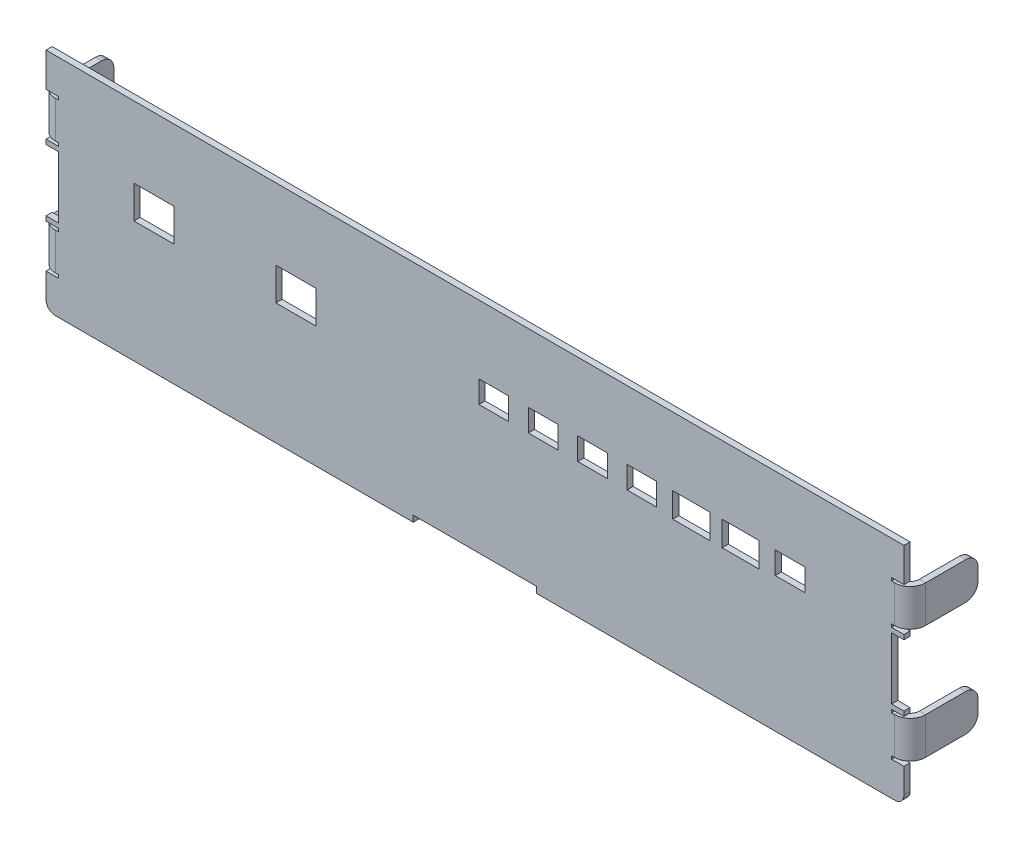
from build123d import *

# Parameters (mm, degrees)
SKETCH1_W                       = 139
SKETCH1_H                       = 36.5
BASE_FLANGE1_DEPTH              = 1
EDGE_FLANGE1_STRIP_W            = 7
EDGE_FLANGE1_STRIP_H            = 1
EDGE_FLANGE1_STRIP_CUT_DEPTH    = 6
EDGE_FLANGE1_RELIEF_W           = 7.5
EDGE_FLANGE1_RELIEF_H           = 0.5
EDGE_FLANGE1_RELIEF_CUT_DEPTH   = 1
EDGE_FLANGE1_STRIP_2_W          = 7
EDGE_FLANGE1_STRIP_2_H          = 1
EDGE_FLANGE1_STRIP_CUT_2_DEPTH  = 6
EDGE_FLANGE1_RELIEF_2_W         = 7.5
EDGE_FLANGE1_RELIEF_2_H         = 0.5
EDGE_FLANGE1_RELIEF_CUT_2_DEPTH = 1
EDGE_FLANGE1_DEPTH              = 6
EDGE_FLANGE1_START              = -1
EDGE_FLANGE1_FLAT_DEPTH         = 1
EDGE_FLANGE1_BEND_DEPTH         = 6
EDGE_FLANGE1_FLAT_2_DEPTH       = 1
EDGE_FLANGE2_STRIP_W            = 7
EDGE_FLANGE2_STRIP_H            = 1
EDGE_FLANGE2_STRIP_CUT_DEPTH    = 6
EDGE_FLANGE2_RELIEF_W           = 7.5
EDGE_FLANGE2_RELIEF_H           = 0.5
EDGE_FLANGE2_RELIEF_CUT_DEPTH   = 1
EDGE_FLANGE2_STRIP_2_W          = 7
EDGE_FLANGE2_STRIP_2_H          = 1
EDGE_FLANGE2_STRIP_CUT_2_DEPTH  = 6
EDGE_FLANGE2_RELIEF_2_W         = 7.5
EDGE_FLANGE2_RELIEF_2_H         = 0.5
EDGE_FLANGE2_RELIEF_CUT_2_DEPTH = 1
EDGE_FLANGE2_DEPTH              = 6
EDGE_FLANGE2_START              = 1
EDGE_FLANGE2_FLAT_DEPTH         = 1
EDGE_FLANGE2_BEND_DEPTH         = 6
EDGE_FLANGE2_FLAT_2_DEPTH       = 1
SKETCH20_W                      = 20
SKETCH20_H                      = 1
SKETCH20_W_2                    = 2
SKETCH20_H_2                    = 10
CUT_EXTRUDE1_DEPTH              = 10
FILLET1_R                       = 1.5
SKETCH28_W                      = 4.80000148
SKETCH28_H                      = 3.5999988
SKETCH28_H_2                    = 3.597941299
SKETCH28_W_2                    = 5.99999908
SKETCH28_H_3                    = 4.00000054
SKETCH28_W_3                    = 6.50000116
SKETCH28_H_4                    = 5.30000102
CUT_EXTRUDE3_DEPTH              = 10


# Sheet-metal steps are written as plain solids
with BuildPart() as part:
    # Sketch1 → Base-Flange1 (new body)
    with BuildSketch(Plane.XY):
        with Locations((0.929014267, 0)):
            Rectangle(SKETCH1_W, SKETCH1_H)
    extrude(amount=-BASE_FLANGE1_DEPTH)

    # Edge-Flange1 strip (across the edge) → Edge-Flange1 strip cut (cut)
    with BuildSketch(Plane(origin=(-68.570985733, 6.25, -1), x_dir=(1, 0, 0), z_dir=(0, 1, 0))):
        with Locations((-2, -0.5)):
            Rectangle(EDGE_FLANGE1_STRIP_W, EDGE_FLANGE1_STRIP_H)
    extrude(amount=EDGE_FLANGE1_STRIP_CUT_DEPTH, mode=Mode.SUBTRACT)

    # Edge-Flange1 relief (on the sheet) → Edge-Flange1 relief cut (cut)
    with BuildSketch(Plane(origin=(-67.070985733, 6.25, -1), x_dir=(1, 0, 0), z_dir=(0, 0, -1))):
        with Locations((-3.25, 0.25)):
            Rectangle(EDGE_FLANGE1_RELIEF_W, EDGE_FLANGE1_RELIEF_H)
        with Locations((-3.25, -6.25)):
            Rectangle(EDGE_FLANGE1_RELIEF_W, EDGE_FLANGE1_RELIEF_H)
    extrude(amount=-EDGE_FLANGE1_RELIEF_CUT_DEPTH, mode=Mode.SUBTRACT)

    # Edge-Flange1 strip 2 (across the edge) → Edge-Flange1 strip cut 2 (cut)
    with BuildSketch(Plane(origin=(70.429014267, 12.25, -1), x_dir=(-1, 0, 0), z_dir=(0, -1, 0))):
        with Locations((-2, -0.5)):
            Rectangle(EDGE_FLANGE1_STRIP_2_W, EDGE_FLANGE1_STRIP_2_H)
    extrude(amount=EDGE_FLANGE1_STRIP_CUT_2_DEPTH, mode=Mode.SUBTRACT)

    # Edge-Flange1 relief 2 (on the sheet) → Edge-Flange1 relief cut 2 (cut)
    with BuildSketch(Plane(origin=(68.929014267, 12.25, -1), x_dir=(-1, 0, 0), z_dir=(0, 0, -1))):
        with Locations((-3.25, 0.25)):
            Rectangle(EDGE_FLANGE1_RELIEF_2_W, EDGE_FLANGE1_RELIEF_2_H)
        with Locations((-3.25, -6.25)):
            Rectangle(EDGE_FLANGE1_RELIEF_2_W, EDGE_FLANGE1_RELIEF_2_H)
    extrude(amount=-EDGE_FLANGE1_RELIEF_CUT_2_DEPTH, mode=Mode.SUBTRACT)

    # Edge-Flange1 bend section (across the edge) → Edge-Flange1 (add)
    with BuildSketch(Plane(origin=(-68.570985733, 6.25, -1), x_dir=(1, 0, 0), z_dir=(0, 1, 0))):
        with BuildLine():
            Line((-1, 1.5), (0, 1.5))
            ThreePointArc((0, 1.5), (0.439339828, 0.439339828), (1.5, 0))
            Line((1.5, 0), (1.5, -1))
            ThreePointArc((1.5, -1), (-0.267766953, -0.267766953), (-1, 1.5))
        make_face()
    extrude(amount=EDGE_FLANGE1_DEPTH)

    # Edge-Flange1 profile (on flange) → Edge-Flange1 flat (add)
    with BuildSketch(Plane(origin=(-68.570985733, 0, -1), x_dir=(0, -1, 0), z_dir=(1, 0, 0)).offset(EDGE_FLANGE1_START)):
        with BuildLine():
            ThreePointArc((-6.25, 8), (-6.835786438, 9.414213562), (-8.25, 10))
            Line((-8.25, 10), (-10.25, 10))
            ThreePointArc((-10.25, 10), (-11.664213562, 9.414213562), (-12.25, 8))
            Line((-12.25, 8), (-12.25, 1.5))
            Line((-12.25, 1.5), (-6.25, 1.5))
            Line((-6.25, 1.5), (-6.25, 8))
        make_face()
    extrude(amount=EDGE_FLANGE1_FLAT_DEPTH)

    # Edge-Flange1 bend section 2 (across the edge) → Edge-Flange1 bend (add)
    with BuildSketch(Plane(origin=(70.429014267, 12.25, -1), x_dir=(-1, 0, 0), z_dir=(0, -1, 0))):
        with BuildLine():
            Line((-1, 1.5), (0, 1.5))
            ThreePointArc((0, 1.5), (0.439339828, 0.439339828), (1.5, 0))
            Line((1.5, 0), (1.5, -1))
            ThreePointArc((1.5, -1), (-0.267766953, -0.267766953), (-1, 1.5))
        make_face()
    extrude(amount=EDGE_FLANGE1_BEND_DEPTH)

    # Edge-Flange1 profile 2 (on flange) → Edge-Flange1 flat 2 (add)
    with BuildSketch(Plane(origin=(70.429014267, 0, -1), x_dir=(0, 1, 0), z_dir=(-1, 0, 0)).offset(EDGE_FLANGE1_START)):
        with BuildLine():
            Line((12.25, 1.5), (12.25, 8))
            ThreePointArc((12.25, 8), (11.664213562, 9.414213562), (10.25, 10))
            Line((10.25, 10), (8.25, 10))
            ThreePointArc((8.25, 10), (6.835786438, 9.414213562), (6.25, 8))
            Line((6.25, 8), (6.25, 1.5))
            Line((6.25, 1.5), (12.25, 1.5))
        make_face()
    extrude(amount=EDGE_FLANGE1_FLAT_2_DEPTH)

    # Edge-Flange2 strip (across the edge) → Edge-Flange2 strip cut (cut)
    with BuildSketch(Plane(origin=(70.429014267, -6.25, -1), x_dir=(-1, 0, 0), z_dir=(0, -1, 0))):
        with Locations((-2, -0.5)):
            Rectangle(EDGE_FLANGE2_STRIP_W, EDGE_FLANGE2_STRIP_H)
    extrude(amount=EDGE_FLANGE2_STRIP_CUT_DEPTH, mode=Mode.SUBTRACT)

    # Edge-Flange2 relief (on the sheet) → Edge-Flange2 relief cut (cut)
    with BuildSketch(Plane(origin=(68.929014267, -6.25, -1), x_dir=(-1, 0, 0), z_dir=(0, 0, -1))):
        with Locations((-3.25, 0.25)):
            Rectangle(EDGE_FLANGE2_RELIEF_W, EDGE_FLANGE2_RELIEF_H)
        with Locations((-3.25, -6.25)):
            Rectangle(EDGE_FLANGE2_RELIEF_W, EDGE_FLANGE2_RELIEF_H)
    extrude(amount=-EDGE_FLANGE2_RELIEF_CUT_DEPTH, mode=Mode.SUBTRACT)

    # Edge-Flange2 strip 2 (across the edge) → Edge-Flange2 strip cut 2 (cut)
    with BuildSketch(Plane(origin=(-68.570985733, -12.25, -1), x_dir=(1, 0, 0), z_dir=(0, 1, 0))):
        with Locations((-2, -0.5)):
            Rectangle(EDGE_FLANGE2_STRIP_2_W, EDGE_FLANGE2_STRIP_2_H)
    extrude(amount=EDGE_FLANGE2_STRIP_CUT_2_DEPTH, mode=Mode.SUBTRACT)

    # Edge-Flange2 relief 2 (on the sheet) → Edge-Flange2 relief cut 2 (cut)
    with BuildSketch(Plane(origin=(-67.070985733, -12.25, -1), x_dir=(1, 0, 0), z_dir=(0, 0, -1))):
        with Locations((-3.25, 0.25)):
            Rectangle(EDGE_FLANGE2_RELIEF_2_W, EDGE_FLANGE2_RELIEF_2_H)
        with Locations((-3.25, -6.25)):
            Rectangle(EDGE_FLANGE2_RELIEF_2_W, EDGE_FLANGE2_RELIEF_2_H)
    extrude(amount=-EDGE_FLANGE2_RELIEF_CUT_2_DEPTH, mode=Mode.SUBTRACT)

    # Edge-Flange2 bend section (across the edge) → Edge-Flange2 (add)
    with BuildSketch(Plane(origin=(70.429014267, -6.25, -1), x_dir=(-1, 0, 0), z_dir=(0, -1, 0))):
        with BuildLine():
            Line((-1, 1.5), (0, 1.5))
            ThreePointArc((0, 1.5), (0.439339828, 0.439339828), (1.5, 0))
            Line((1.5, 0), (1.5, -1))
            ThreePointArc((1.5, -1), (-0.267766953, -0.267766953), (-1, 1.5))
        make_face()
    extrude(amount=EDGE_FLANGE2_DEPTH)

    # Edge-Flange2 profile (on flange) → Edge-Flange2 flat (add)
    with BuildSketch(Plane(origin=(70.429014267, 0, -1), x_dir=(0, -1, 0), z_dir=(1, 0, 0)).offset(EDGE_FLANGE2_START)):
        with BuildLine():
            Line((12.25, 1.5), (12.25, 8))
            ThreePointArc((12.25, 8), (11.664213562, 9.414213562), (10.25, 10))
            Line((10.25, 10), (8.25, 10))
            ThreePointArc((8.25, 10), (6.835786438, 9.414213562), (6.25, 8))
            Line((6.25, 8), (6.25, 1.5))
            Line((6.25, 1.5), (12.25, 1.5))
        make_face()
    extrude(amount=-EDGE_FLANGE2_FLAT_DEPTH)

    # Edge-Flange2 bend section 2 (across the edge) → Edge-Flange2 bend (add)
    with BuildSketch(Plane(origin=(-68.570985733, -12.25, -1), x_dir=(1, 0, 0), z_dir=(0, 1, 0))):
        with BuildLine():
            Line((-1, 1.5), (0, 1.5))
            ThreePointArc((0, 1.5), (0.439339828, 0.439339828), (1.5, 0))
            Line((1.5, 0), (1.5, -1))
            ThreePointArc((1.5, -1), (-0.267766953, -0.267766953), (-1, 1.5))
        make_face()
    extrude(amount=EDGE_FLANGE2_BEND_DEPTH)

    # Edge-Flange2 profile 2 (on flange) → Edge-Flange2 flat 2 (add)
    with BuildSketch(Plane(origin=(-68.570985733, 0, -1), x_dir=(0, 1, 0), z_dir=(-1, 0, 0)).offset(EDGE_FLANGE2_START)):
        with BuildLine():
            ThreePointArc((-6.25, 8), (-6.835786438, 9.414213562), (-8.25, 10))
            Line((-8.25, 10), (-10.25, 10))
            ThreePointArc((-10.25, 10), (-11.664213562, 9.414213562), (-12.25, 8))
            Line((-12.25, 8), (-12.25, 1.5))
            Line((-12.25, 1.5), (-6.25, 1.5))
            Line((-6.25, 1.5), (-6.25, 8))
        make_face()
    extrude(amount=-EDGE_FLANGE2_FLAT_2_DEPTH)

    # Sketch20 → Cut-Extrude1 (cut)
    with BuildSketch(Plane(origin=(0, 0, -1), x_dir=(-1, 0, 0), z_dir=(0, 0, -1))):
        with Locations((-0.929014267, -17.75)):
            Rectangle(SKETCH20_W, SKETCH20_H)
        with Locations((-69.429014267, 0)):
            Rectangle(SKETCH20_W_2, SKETCH20_H_2)
        with Locations((67.570985733, 0)):
            Rectangle(SKETCH20_W_2, SKETCH20_H_2)
    extrude(amount=-CUT_EXTRUDE1_DEPTH, mode=Mode.SUBTRACT)

    # Fillet1
    fillet1_edges = [part.edges().sort_by_distance(p)[0] for p in [
        (70.429014267, -18.25, -0.5),
        (-68.570985733, -18.25, -0.5),
    ]]
    fillet(fillet1_edges, radius=FILLET1_R)

    # Sketch28 → Cut-Extrude3 (cut)
    with BuildSketch(Plane.XY):
        with Locations((3.972975907, 5.4002406)):
            Rectangle(SKETCH28_W, SKETCH28_H)
        with Locations((11.972975147, 5.4002406)):
            Rectangle(SKETCH28_W, SKETCH28_H)
        with Locations((19.972974387, 5.4002406)):
            Rectangle(SKETCH28_W, SKETCH28_H)
        with Locations((27.972973627, 5.39921185)):
            Rectangle(SKETCH28_W, SKETCH28_H_2)
        with Locations((35.972972867, 5.20023973)):
            Rectangle(SKETCH28_W_2, SKETCH28_H_3)
        with Locations((43.972972107, 5.20023973)):
            Rectangle(SKETCH28_W_2, SKETCH28_H_3)
        with Locations((51.972971347, 5.4002406)):
            Rectangle(SKETCH28_W, SKETCH28_H)
        with Locations((-51.082027013, 4.05023949)):
            Rectangle(SKETCH28_W_3, SKETCH28_H_4)
        with Locations((-28.082027293, 4.05023949)):
            Rectangle(SKETCH28_W_3, SKETCH28_H_4)
    extrude(amount=-CUT_EXTRUDE3_DEPTH, mode=Mode.SUBTRACT)


solid = part.part
